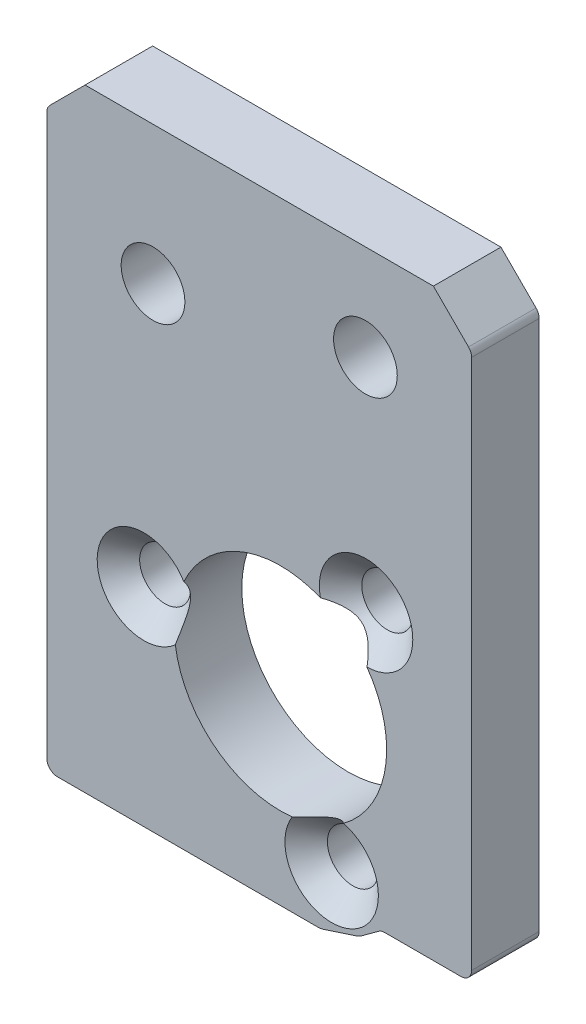
from build123d import *

# Parameters (mm, degrees)
SKETCH1_W                                       = 20
SKETCH1_H                                       = 29.11
SKETCH1_R                                       = 5
SKETCH1_R_2                                     = 1.5
SKETCH1_R_3                                     = 1.2
BOSS_EXTRUDE2_DEPTH                             = 3.18
CSK_FOR_M2_FLAT_HEAD_MACHINE_SCREW1_D           = 2.4
CSK_FOR_M2_FLAT_HEAD_MACHINE_SCREW1_DEPTH       = 3.508967257
CSK_FOR_M2_FLAT_HEAD_MACHINE_SCREW1_CSINK_D     = 4.4
CSK_FOR_M2_FLAT_HEAD_MACHINE_SCREW1_CSINK_ANGLE = 90
CSK_FOR_M2_FLAT_HEAD_MACHINE_SCREW1_TIP         = 0.721032743
CHAMFER1_SIZE                                   = 1.8
FILLET1_R                                       = 0.5
CUT_EXTRUDE1_DEPTH                              = 4
FILLET6_R                                       = 0.5
CUT_EXTRUDE2_DEPTH                              = 4
FILLET8_R                                       = 1


with BuildPart() as part:
    # Sketch1 → Boss-Extrude2 (new body)
    with BuildSketch(Plane.XY):
        with Locations((10, 14.555)):
            Rectangle(SKETCH1_W, SKETCH1_H)
        with Locations((11, 9.11)):
            Circle(SKETCH1_R, mode=Mode.SUBTRACT)
        with Locations((5, 22.61)):
            Circle(SKETCH1_R_2, mode=Mode.SUBTRACT)
        with Locations((15, 24.61)):
            Circle(SKETCH1_R_2, mode=Mode.SUBTRACT)
        with Locations((15.03, 14.21)):
            Circle(SKETCH1_R_3, mode=Mode.SUBTRACT)
        with Locations((4.57, 10.04)):
            Circle(SKETCH1_R_3, mode=Mode.SUBTRACT)
        with Locations((13.41, 2.96)):
            Circle(SKETCH1_R_3, mode=Mode.SUBTRACT)
    extrude(amount=-BOSS_EXTRUDE2_DEPTH)

    # CSK for M2 Flat Head Machine Screw1
    with Locations(Plane.XY):
        with Locations((4.57, 10.04), (15.03, 14.21), (13.41, 2.96)):
            CounterSinkHole(CSK_FOR_M2_FLAT_HEAD_MACHINE_SCREW1_D / 2, CSK_FOR_M2_FLAT_HEAD_MACHINE_SCREW1_CSINK_D / 2, depth=CSK_FOR_M2_FLAT_HEAD_MACHINE_SCREW1_DEPTH, counter_sink_angle=CSK_FOR_M2_FLAT_HEAD_MACHINE_SCREW1_CSINK_ANGLE)
            with Locations((0, 0, -(CSK_FOR_M2_FLAT_HEAD_MACHINE_SCREW1_DEPTH + CSK_FOR_M2_FLAT_HEAD_MACHINE_SCREW1_TIP / 2))):  # 118° drill point
                Cone(0, CSK_FOR_M2_FLAT_HEAD_MACHINE_SCREW1_D / 2, CSK_FOR_M2_FLAT_HEAD_MACHINE_SCREW1_TIP, mode=Mode.SUBTRACT)

    # Chamfer1
    chamfer1_edges = [part.edges().sort_by_distance(p)[0] for p in [
        (0, 29.11, -1.59),
        (20, 29.11, -1.59),
    ]]
    chamfer(chamfer1_edges, length=CHAMFER1_SIZE)

    # Fillet1
    fillet1_edges = [part.edges().sort_by_distance(p)[0] for p in [
        (20, 27.31, -1.59),
        (0, 27.31, -1.59),
    ]]
    fillet(fillet1_edges, radius=FILLET1_R)

    # Sketch12 → Cut-Extrude1 (cut)
    with BuildSketch(Plane(origin=(0, 0, -3.18), x_dir=(-1, 0, 0), z_dir=(0, 0, -1))):
        Polygon((0, 0), (-20, 0), (-20, 1.60680291), (-15.748577863, 1.60680291), (-13.898929975, 0.251358625), (0, 0.251358625), align=None)
    extrude(amount=-CUT_EXTRUDE1_DEPTH, mode=Mode.SUBTRACT)

    # Fillet6
    fillet6_edges = [part.edges().sort_by_distance(p)[0] for p in [
        (0, 0.251358625, -1.59),
        (15.748577863, 1.60680291, -1.59),
        (20, 1.60680291, -1.59),
    ]]
    fillet(fillet6_edges, radius=FILLET6_R)

    # Sketch14 → Cut-Extrude2 (cut)
    with BuildSketch(Plane.XY):
        Polygon((12.898929975, 0.251358625), (13.898929975, 0.251358625), (14.705535433, 0.842448835), align=None)
    extrude(amount=-CUT_EXTRUDE2_DEPTH, mode=Mode.SUBTRACT)

    # Fillet8
    fillet8_edges = [part.edges().sort_by_distance(p)[0] for p in [
        (12.898929975, 0.251358625, -1.59),
        (14.705535433, 0.842448835, -1.59),
    ]]
    fillet(fillet8_edges, radius=FILLET8_R)


solid = part.part
